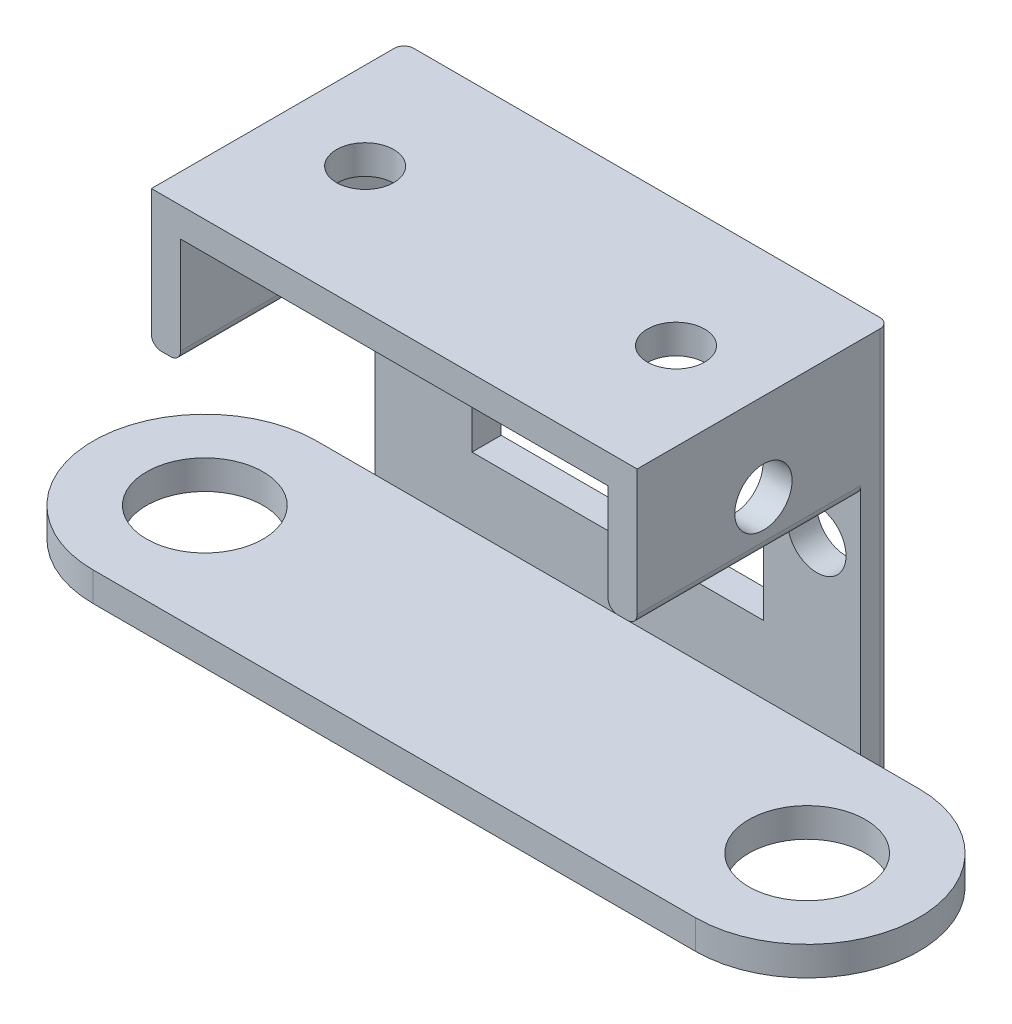
from build123d import *

# Parameters (mm, degrees)
SKETCH_1_W          = 25
SKETCH_1_H          = 20
EXTRUDE_1_DEPTH     = 13
SHELL_7_T           = -1.5
SKETCH_3_R          = 1.5
CUT_EXTRUDE_1_DEPTH = 5
SKETCH_4_W          = 15
SKETCH_4_H          = 10
CUT_EXTRUDE_2_DEPTH = 2
SKETCH_6_W          = 12.730573974
SKETCH_6_H          = 22.360557323
CUT_EXTRUDE_5_DEPTH = 38.5
EXTRUDE_START       = -1.5
EXTRUDE_4_OUTLINE_R = 3
EXTRUDE_4_DEPTH     = 1.5
EXTRUDE_5_DEPTH     = 11.5
SKETCH_12_R         = 1.475
CUT_EXTRUDE_6_DEPTH = 1.5
SKETCH_14_R         = 1.475
CUT_EXTRUDE_7_DEPTH = 27
FILLET_2_R          = 0.5
FILLET_3_R          = 0.5
FILLET_4_R          = 0.5
FILLET_5_R          = 0.5
FILLET_6_R          = 0.5
FILLET_7_R          = 0.5


with BuildPart() as part:
    # 草图1 → 凸台-拉伸1 (new body)
    with BuildSketch(Plane.XY):
        Rectangle(SKETCH_1_W, SKETCH_1_H)
    extrude(amount=EXTRUDE_1_DEPTH)

    # 抽壳7
    shell_7_openings = [part.faces().sort_by_distance(p)[0] for p in [
        (0, 0, 13),
    ]]
    offset(amount=SHELL_7_T, openings=shell_7_openings, kind=Kind.INTERSECTION)

    # 草图3 → 切除-拉伸1 (cut)
    with BuildSketch(Plane.XY.offset(1.5)):
        with Locations((-10.25, 0)):
            Circle(SKETCH_3_R)
        with Locations((10.25, 0)):
            Circle(SKETCH_3_R)
    extrude(amount=-CUT_EXTRUDE_1_DEPTH, mode=Mode.SUBTRACT)

    # 草图4 → 切除-拉伸2 (cut)
    with BuildSketch(Plane.XY.offset(1.5)):
        Rectangle(SKETCH_4_W, SKETCH_4_H)
    extrude(amount=-CUT_EXTRUDE_2_DEPTH, mode=Mode.SUBTRACT)

    # 草图6 → 切除-拉伸5 (cut, symmetric)
    with BuildSketch(Plane(origin=(-11, 0, 0), x_dir=(0, 0, -1), z_dir=(1, 0, 0))):
        with Locations((-7.865286987, 2.680278662)):
            Rectangle(SKETCH_6_W, SKETCH_6_H)
    extrude(amount=CUT_EXTRUDE_5_DEPTH, both=True, mode=Mode.SUBTRACT)

    # 凸台-拉伸4: read off the stored shape, not the designer's step
    # 凸台-拉伸4 outline → 凸台-拉伸4 (add)
    with BuildSketch(Plane(origin=(0, -8.5, 0), x_dir=(1, 0, 0), z_dir=(0, 1, 0)).offset(EXTRUDE_START)):
        with BuildLine():
            Line((15.5, -1.5), (-15.5, -1.5))
            ThreePointArc((-15.5, -1.5), (-21.25, -7.25), (-15.5, -13))
            Line((-15.5, -13), (15.5, -13))
            ThreePointArc((15.5, -13), (21.25, -7.25), (15.5, -1.5))
        make_face()
        with Locations((-15.5, -7.25)):
            Circle(EXTRUDE_4_OUTLINE_R, mode=Mode.SUBTRACT)
        with Locations((15.5, -7.25)):
            Circle(EXTRUDE_4_OUTLINE_R, mode=Mode.SUBTRACT)
    extrude(amount=EXTRUDE_4_DEPTH)

    # 草图11 → 凸台-拉伸5 (add)
    with BuildSketch(Plane.XY.offset(1.5)):
        Polygon((-11, 8.5), (11, 8.5), (11, 3), (12.5, 3), (12.5, 10), (-12.5, 10), (-12.5, 3), (-11, 3), align=None)
    extrude(amount=EXTRUDE_5_DEPTH)

    # 草图12 → 切除-拉伸6 (cut)
    with BuildSketch(Plane(origin=(0, 10, 0), x_dir=(1, 0, 0), z_dir=(0, 1, 0))):
        with Locations(Location((-8, -6.5, 0), (0, 0, 270))):
            Circle(SKETCH_12_R)
        with Locations(Location((8, -6.5, 0), (0, 0, 90))):
            Circle(SKETCH_12_R)
    extrude(amount=-CUT_EXTRUDE_6_DEPTH, mode=Mode.SUBTRACT)

    # 草图14 → 切除-拉伸7 (cut)
    with BuildSketch(Plane.ZY.offset(12.5)):
        with Locations(Location((6.5, 5.5, 0), (0, 0, 270))):
            Circle(SKETCH_14_R)
    extrude(amount=-CUT_EXTRUDE_7_DEPTH, mode=Mode.SUBTRACT)

    # 圆角2
    fillet_2_edges = [part.edges().sort_by_distance(p)[0] for p in [
        (-12.5, 0, 0),
    ]]
    fillet(fillet_2_edges, radius=FILLET_2_R)

    # 圆角3
    fillet_3_edges = [part.edges().sort_by_distance(p)[0] for p in [
        (12.5, 0, 0),
    ]]
    fillet(fillet_3_edges, radius=FILLET_3_R)

    # 圆角4
    fillet_4_edges = [part.edges().sort_by_distance(p)[0] for p in [
        (12.5, 3, 7.25),
    ]]
    fillet(fillet_4_edges, radius=FILLET_4_R)

    # 圆角5
    fillet_5_edges = [part.edges().sort_by_distance(p)[0] for p in [
        (11, 3, 7.25),
    ]]
    fillet(fillet_5_edges, radius=FILLET_5_R)

    # 圆角6
    fillet_6_edges = [part.edges().sort_by_distance(p)[0] for p in [
        (-12.5, 3, 7.25),
    ]]
    fillet(fillet_6_edges, radius=FILLET_6_R)

    # 圆角7
    fillet_7_edges = [part.edges().sort_by_distance(p)[0] for p in [
        (-11, 3, 7.25),
    ]]
    fillet(fillet_7_edges, radius=FILLET_7_R)


solid = part.part
